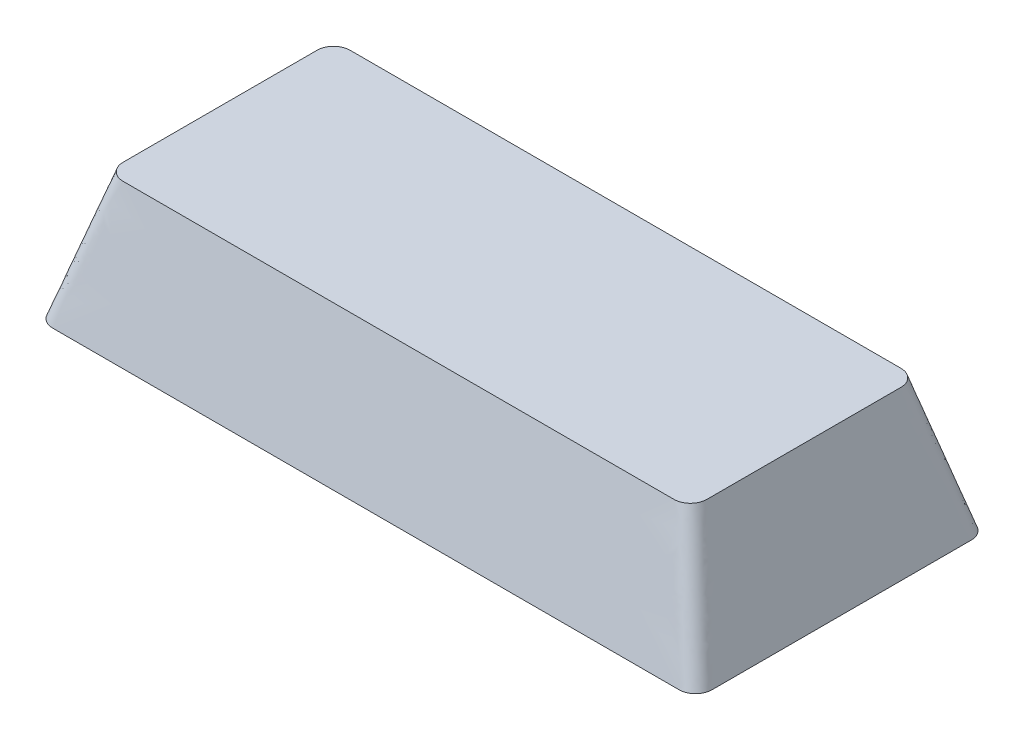
from build123d import *


with BuildPart() as part:
    # Croquis3 for Recubrir1 → Recubrir1 section 0
    with BuildSketch(Plane(origin=(0, 8.001, 0), x_dir=(1, 0, 0), z_dir=(0, 1, 0))):
        with BuildLine():
            Line((-16.9799, -6.9977), (16.9799, -6.9977))
            # circular arc as an exact rational Bezier (weights 1, cos(half-angle), 1)
            Bezier((16.9799, -6.9977), (17.9959, -6.9977), (17.9959, -5.9817), weights=[1, 0.707106781, 1])
            Line((17.9959, -5.9817), (17.9959, 5.9817))
            Bezier((17.9959, 5.9817), (17.9959, 6.9977), (16.9799, 6.9977), weights=[1, 0.707106781, 1])
            Line((16.9799, 6.9977), (-16.9799, 6.9977))
            Bezier((-16.9799, 6.9977), (-17.9959, 6.9977), (-17.9959, 5.9817), weights=[1, 0.707106781, 1])
            Line((-17.9959, 5.9817), (-17.9959, -5.9817))
            Bezier((-17.9959, -5.9817), (-17.9959, -6.9977), (-16.9799, -6.9977), weights=[1, 0.707106781, 1])
        make_face()
    # Croquis2 for Recubrir1 → Recubrir1 section 1
    with BuildSketch(Plane(origin=(0, 0, 0), x_dir=(1, 0, 0), z_dir=(0, 1, 0))):
        with BuildLine():
            Line((-19.304, -9.0043), (19.304, -9.0043))
            Bezier((19.304, -9.0043), (20.32, -9.0043), (20.32, -7.9883), weights=[1, 0.707106781, 1])
            Line((20.32, -7.9883), (20.32, 7.9883))
            Bezier((20.32, 7.9883), (20.32, 9.0043), (19.304, 9.0043), weights=[1, 0.707106781, 1])
            Line((19.304, 9.0043), (-19.304, 9.0043))
            Bezier((-19.304, 9.0043), (-20.32, 9.0043), (-20.32, 7.9883), weights=[1, 0.707106781, 1])
            Line((-20.32, 7.9883), (-20.32, -7.9883))
            Bezier((-20.32, -7.9883), (-20.32, -9.0043), (-19.304, -9.0043), weights=[1, 0.707106781, 1])
        make_face()
    loft()


solid = part.part
